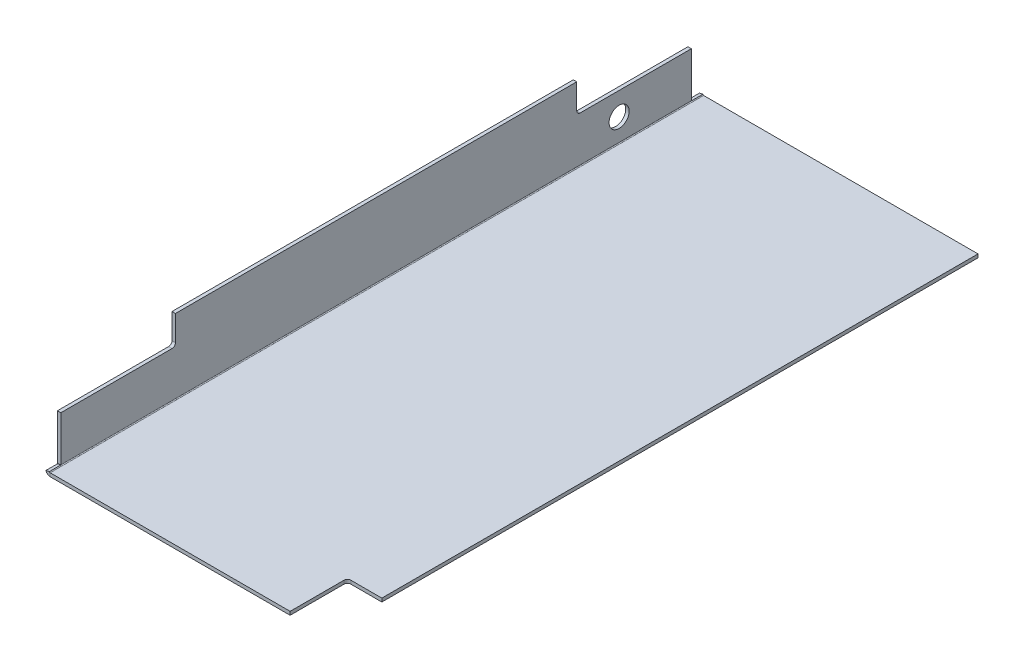
from build123d import *

# Parameters (mm, degrees)
BASE_FLANGE1_DEPTH       = 570
CUT_EXTRUDE1_OUTLINE_W   = 3
CUT_EXTRUDE1_OUTLINE_H   = 25
CUT_EXTRUDE1_DEPTH       = 107
CUT_EXTRUDE1_START       = 463
CUT_EXTRUDE1_2_OUTLINE_W = 3
CUT_EXTRUDE1_2_OUTLINE_H = 25
CUT_EXTRUDE1_2_DEPTH     = 107
CUT_EXTRUDE1_START_2     = -32
CUT_EXTRUDE1_3_DEPTH     = 5
CUT_EXTRUDE1_START_3     = -1
CUT_EXTRUDE1_4_DEPTH     = 11
CUT_EXTRUDE1_START_4     = 560
CUT_EXTRUDE1_5_DEPTH     = 11
CUT_EXTRUDE3_REACH       = 613.523
CUT_EXTRUDE4_REACH       = 623.872
SKETCH8_R                = 8.75


with BuildPart() as part:
    # Base-Flange1: sheet metal written as solids
    # Sketch1 → Base-Flange1 (new body)
    with BuildSketch(Plane.XY):
        with BuildLine():
            Line((-28.256118786, 65), (-28.256118786, 0.7366))
            ThreePointArc((-28.256118786, 0.7366), (-28.040373641, 0.215745145), (-27.519518786, 0))
            Line((-27.519518786, 0), (211.743881214, 0))
            Line((211.743881214, 0), (211.743881214, -3))
            Line((211.743881214, -3), (-27.519518786, -3))
            ThreePointArc((-27.519518786, -3), (-30.161693985, -1.905575199), (-31.256118786, 0.7366))
            Line((-31.256118786, 0.7366), (-31.256118786, 65))
            Line((-31.256118786, 65), (-28.256118786, 65))
        make_face()
    extrude(amount=BASE_FLANGE1_DEPTH)

    # Cut-Extrude1: read off the stored shape, not the designer's step
    # Cut-Extrude1 outline → Cut-Extrude1 (cut)
    with BuildSketch(Plane.XY):
        with Locations((-29.756118786, 52.5)):
            Rectangle(CUT_EXTRUDE1_OUTLINE_W, CUT_EXTRUDE1_OUTLINE_H)
    extrude(amount=CUT_EXTRUDE1_DEPTH, mode=Mode.SUBTRACT)

    # Cut-Extrude1 2 outline → Cut-Extrude1 2 (cut)
    with BuildSketch(Plane.XY.offset(CUT_EXTRUDE1_START)):
        with Locations((-29.756118786, 52.5)):
            Rectangle(CUT_EXTRUDE1_2_OUTLINE_W, CUT_EXTRUDE1_2_OUTLINE_H)
    extrude(amount=CUT_EXTRUDE1_2_DEPTH, mode=Mode.SUBTRACT)

    # Cut-Extrude1 3 outline → Cut-Extrude1 3 (cut)
    with BuildSketch(Plane.YZ.offset(CUT_EXTRUDE1_START_2)):
        with BuildLine():
            Line((65, 110), (43, 110))
            ThreePointArc((43, 110), (40.878679656, 109.121320344), (40, 107))
            Line((40, 107), (65, 107))
            Line((65, 107), (65, 110))
        make_face()
        with BuildLine():
            Line((43, 460), (65, 460))
            Line((65, 460), (65, 463))
            Line((65, 463), (40, 463))
            ThreePointArc((40, 463), (40.878679656, 460.878679656), (43, 460))
        make_face()
    extrude(amount=CUT_EXTRUDE1_3_DEPTH, mode=Mode.SUBTRACT)

    # Cut-Extrude1 4 outline → Cut-Extrude1 4 (cut)
    with BuildSketch(Plane.XY.offset(CUT_EXTRUDE1_START_3)):
        with BuildLine():
            Line((-31.182796008, 0), (-28.241664587, 0.591393245))
            ThreePointArc((-28.241664587, 0.591393245), (-28.252496329, 0.663637809), (-28.256118786, 0.7366))
            Line((-28.256118786, 0.7366), (-28.256118786, 40))
            Line((-28.256118786, 40), (-31.256118786, 40))
            Line((-31.256118786, 40), (-31.256118786, 0.7366))
            ThreePointArc((-31.256118786, 0.7366), (-31.237742907, 0.36647982), (-31.182796008, 0))
        make_face()
    extrude(amount=CUT_EXTRUDE1_4_DEPTH, mode=Mode.SUBTRACT)

    # Cut-Extrude1 5 outline → Cut-Extrude1 5 (cut)
    with BuildSketch(Plane.XY.offset(CUT_EXTRUDE1_START_4)):
        with BuildLine():
            Line((-31.182796008, 0), (-28.241664587, 0.591393245))
            ThreePointArc((-28.241664587, 0.591393245), (-28.252496329, 0.663637809), (-28.256118786, 0.7366))
            Line((-28.256118786, 0.7366), (-28.256118786, 40))
            Line((-28.256118786, 40), (-31.256118786, 40))
            Line((-31.256118786, 40), (-31.256118786, 0.7366))
            ThreePointArc((-31.256118786, 0.7366), (-31.237742907, 0.36647982), (-31.182796008, 0))
        make_face()
    extrude(amount=CUT_EXTRUDE1_5_DEPTH, mode=Mode.SUBTRACT)

    # Sketch7 → Cut-Extrude3 (cut, up to next)
    with BuildSketch(Plane(origin=(0, 0, 0), x_dir=(1, 0, 0), z_dir=(0, 1, 0)), mode=Mode.PRIVATE) as cut_extrude3_sk1:
        with BuildLine():
            Line((211.743881214, -520), (184.743881214, -520))
            ThreePointArc((184.743881214, -520), (182.62256087, -520.878679656), (181.743881214, -523))
            Line((181.743881214, -523), (181.743881214, -570))
            Line((181.743881214, -570), (211.743881214, -570))
            Line((211.743881214, -570), (211.743881214, -520))
        make_face()
    cut_extrude3_tool1 = extrude(cut_extrude3_sk1.sketch, amount=-CUT_EXTRUDE3_REACH, mode=Mode.PRIVATE) & part.part
    add(cut_extrude3_tool1.solids().sort_by_distance((196.762356, 0, 545.031368))[0], mode=Mode.SUBTRACT)

    # Sketch8 → Cut-Extrude4 (cut, up to next)
    with BuildSketch(Plane(origin=(-28.256118786, 0, 0), x_dir=(0, 0, -1), z_dir=(1, 0, 0)), mode=Mode.PRIVATE) as cut_extrude4_sk1:
        with Locations(Location((-73.034040989, 20, 0), (0, 0, 90))):
            Circle(SKETCH8_R)
    cut_extrude4_tool1 = extrude(cut_extrude4_sk1.sketch, amount=-CUT_EXTRUDE4_REACH, mode=Mode.PRIVATE) & part.part
    add(cut_extrude4_tool1.solids().sort_by_distance((-28.256119, 20, 73.034041))[0], mode=Mode.SUBTRACT)


solid = part.part
